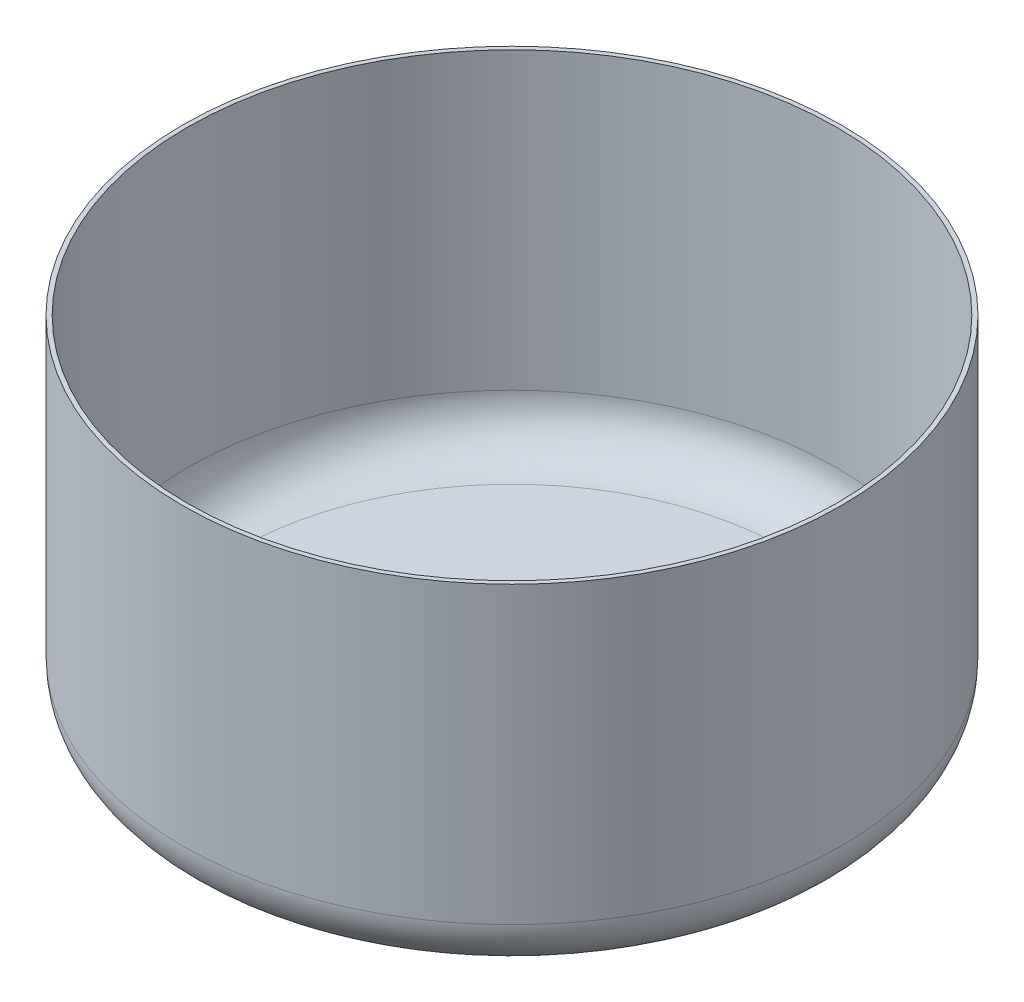
from build123d import *

# Parameters (mm, degrees)
SKETCH1_R           = 482.6
BOSS_EXTRUDE1_DEPTH = 508
FILLET1_R           = 76.2
SHELL1_T            = -6.35


with BuildPart() as part:
    # Sketch1 → Boss-Extrude1 (new body)
    with BuildSketch(Plane(origin=(0, 0, 0), x_dir=(1, 0, 0), z_dir=(0, 1, 0))):
        Circle(SKETCH1_R)
    extrude(amount=BOSS_EXTRUDE1_DEPTH)

    # Fillet1
    fillet1_edges = [part.edges().sort_by_distance(p)[0] for p in [
        (-482.6, 0, 0),
    ]]
    fillet(fillet1_edges, radius=FILLET1_R)

    # Shell1
    shell1_openings = [part.faces().sort_by_distance(p)[0] for p in [
        (0, 508, 0),
    ]]
    offset(amount=SHELL1_T, openings=shell1_openings, kind=Kind.INTERSECTION)


solid = part.part
